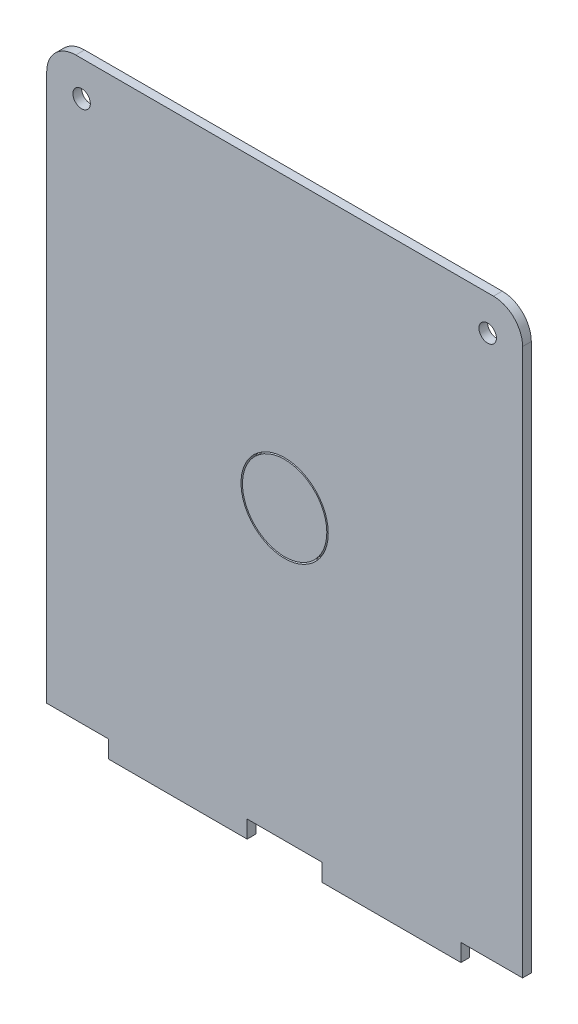
from build123d import *

# Parameters (mm, degrees)
SKETCH1_W           = 81.8
SKETCH1_H           = 102
BOSS_EXTRUDE1_DEPTH = 1.5
SKETCH2_W           = 12.89
SKETCH2_H           = 3
SKETCH2_W_2         = 10.6
SKETCH2_R           = 1.5
CUT_EXTRUDE1_DEPTH  = 131.757370729
FILLET1_R           = 5
SKETCH4_R           = 7.5
SKETCH4_R_2         = 7.25
CUT_EXTRUDE3_DEPTH  = 10


with BuildPart() as part:
    # Sketch1 → Boss-Extrude1 (new body)
    with BuildSketch(Plane.XY):
        with Locations((40.9, 51)):
            Rectangle(SKETCH1_W, SKETCH1_H)
    extrude(amount=BOSS_EXTRUDE1_DEPTH)

    # Sketch2 → Cut-Extrude1 (cut, through all)
    with BuildSketch(Plane.XY.offset(1.5)):
        with Locations((40.9, 1.5)):
            Rectangle(SKETCH2_W, SKETCH2_H)
        with Locations((76.5, 1.5)):
            Rectangle(SKETCH2_W_2, SKETCH2_H)
        with Locations((5.3, 1.5)):
            Rectangle(SKETCH2_W_2, SKETCH2_H)
        with Locations((6, 96)):
            Circle(SKETCH2_R)
        with Locations((75.8, 96)):
            Circle(SKETCH2_R)
    extrude(amount=-CUT_EXTRUDE1_DEPTH, mode=Mode.SUBTRACT)

    # Fillet1
    fillet1_edges = [part.edges().sort_by_distance(p)[0] for p in [
        (81.8, 102, 0.75),
        (0, 102, 0.75),
    ]]
    fillet(fillet1_edges, radius=FILLET1_R)

    # Sketch4 → Cut-Extrude3 (cut)
    with BuildSketch(Plane.XY.offset(1.5)):
        with Locations((40.9, 52.5)):
            Circle(SKETCH4_R)
        with Locations((40.9, 52.5)):
            Circle(SKETCH4_R_2, mode=Mode.SUBTRACT)
    extrude(amount=-CUT_EXTRUDE3_DEPTH, mode=Mode.SUBTRACT)


with BuildPart() as cut_extrude3_piece_1:
    # of the separate pieces the step leaves, piece 1, a body of its own (cut_extrude3_pieces)
    add(part.part.solids().sort_by_distance((0, 97, 0))[0])


with BuildPart() as cut_extrude3_piece_2:
    # of the separate pieces the step leaves, piece 2, a body of its own (cut_extrude3_pieces)
    add(part.part.solids().sort_by_distance((48.15, 52.5, 0))[0])


solid = Compound([cut_extrude3_piece_1.part, cut_extrude3_piece_2.part])
